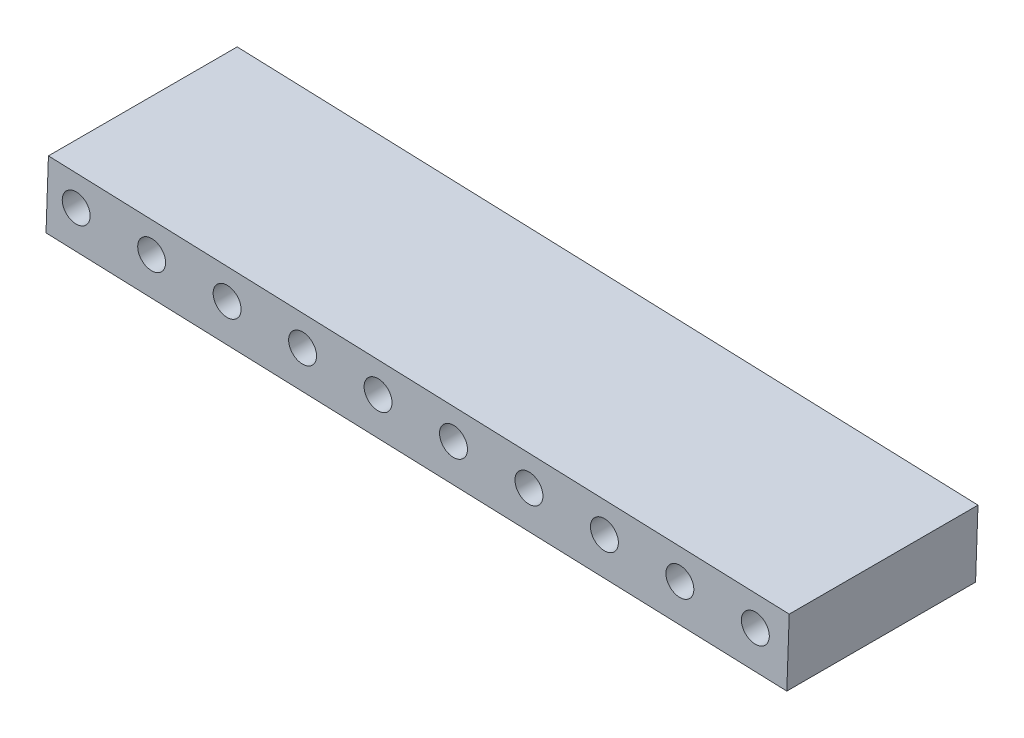
from build123d import *
from build123d.topology import SkipClean

# Parameters (mm, degrees)
EXTRUDE_3_DEPTH           = 5
SKETCH_4_R                = 1.5
SKETCH_4_R_2              = 4
CUT_EXTRUDE_3_DEPTH       = 5
SKETCH_5_R                = 11
CUT_EXTRUDE_4_DEPTH       = 2
SKETCH_6_R                = 1.5
CUT_EXTRUDE_6_DEPTH       = 169.745370307
SKETCH_7_R                = 1.5
CUT_EXTRUDE_7_DEPTH       = 10
SKETCH_8_R                = 11
CUT_EXTRUDE_8_DEPTH       = 10
SKETCH_9_R                = 1.5
CUT_EXTRUDE_9_DEPTH       = 10
SKETCH_10_R               = 5
CUT_EXTRUDE_10_DEPTH      = 10
SKETCH_11_R               = 1.5
SKETCH_11_R_2             = 2
CUT_EXTRUDE_11_DEPTH      = 10
SKETCH_12_W               = 41
SKETCH_12_H               = 22
CUT_EXTRUDE_12_DEPTH      = 10
SKETCH_13_R               = 1.5
CUT_EXTRUDE_13_DEPTH      = 10
EXTRUDE_4_DEPTH           = 5
SKETCH_15_R               = 1.5
EXTRUDE_6_DEPTH           = 5
SKETCH_16_R               = 1.5
CUT_EXTRUDE_14_DEPTH      = 5
EXTRUDE_7_DEPTH           = 5
CUT_EXTRUDE_15_DEPTH      = 5
CUT_EXTRUDE_19_DEPTH      = 5
SKETCH_21_R               = 1.5
CUT_EXTRUDE_20_DEPTH      = 5
EXTRUDE_8_DEPTH           = 10
SKETCH_23_R               = 1.5
CUT_EXTRUDE_21_DEPTH      = 15
SKETCH_24_R               = 1.5
EXTRUDE_9_DEPTH           = 10
SKETCH_25_W               = 266.832769714
SKETCH_25_H               = 72.102740534
CUT_EXTRUDE_22_DEPTH      = 139.940757694
SKETCH_27_R               = 1.85
CUT_EXTRUDE_23_DEPTH      = 139.940757694
CUT_EXTRUDE_25_DEPTH      = 139.940757694
CUT_EXTRUDE_25_DEPTH_BACK = 139.940757694


with BuildPart() as part:
    # 草图1 → 凸台-拉伸3 (new body)
    with BuildSketch(Plane.XY):
        with BuildLine():
            Line((140, 25), (0, 35))
            ThreePointArc((0, 35), (-35, 0), (0, -35))
            Line((0, -35), (140, -25))
            ThreePointArc((140, -25), (165, 0), (140, 25))
        make_face()
    extrude(amount=EXTRUDE_3_DEPTH)

    # 草图4 → 切除-拉伸3 (cut)
    with BuildSketch(Plane.XY.offset(5)):
        with Locations((-5, -5)):
            Circle(SKETCH_4_R)
        with Locations((5, -5)):
            Circle(SKETCH_4_R)
        with Locations((-5, 5)):
            Circle(SKETCH_4_R)
        with Locations((5, 5)):
            Circle(SKETCH_4_R)
        with Locations((135, -5)):
            Circle(SKETCH_4_R)
        with Locations((145, -5)):
            Circle(SKETCH_4_R)
        with Locations((135, 5)):
            Circle(SKETCH_4_R)
        with Locations((145, 5)):
            Circle(SKETCH_4_R)
        Circle(SKETCH_4_R_2)
        with Locations((140, 0)):
            Circle(SKETCH_4_R_2)
    extrude(amount=-CUT_EXTRUDE_3_DEPTH, mode=Mode.SUBTRACT)

    # 草图5 → 切除-拉伸4 (cut)
    with BuildSketch(Plane.XY.offset(5)):
        Circle(SKETCH_5_R)
        with Locations((140, 0)):
            Circle(SKETCH_5_R)
    extrude(amount=-CUT_EXTRUDE_4_DEPTH, mode=Mode.SUBTRACT)

    # 草图6 → 切除-拉伸6 (cut, through all)
    with BuildSketch(Plane.XY.offset(5)):
        with Locations((30, 0)):
            Circle(SKETCH_6_R)
        with Locations((25.980762114, 15)):
            Circle(SKETCH_6_R)
        with Locations((25.980762114, -15)):
            Circle(SKETCH_6_R)
        with Locations((15, 25.980762114)):
            Circle(SKETCH_6_R)
        with Locations((15, -25.980762114)):
            Circle(SKETCH_6_R)
        with Locations((0, 30)):
            Circle(SKETCH_6_R)
        with Locations((0, -30)):
            Circle(SKETCH_6_R)
        with Locations((-15, 25.980762114)):
            Circle(SKETCH_6_R)
        with Locations((-15, -25.980762114)):
            Circle(SKETCH_6_R)
        with Locations((-25.980762114, 15)):
            Circle(SKETCH_6_R)
        with Locations((-25.980762114, -15)):
            Circle(SKETCH_6_R)
        with Locations((-30, 0)):
            Circle(SKETCH_6_R)
        with Locations((160, 0)):
            Circle(SKETCH_6_R)
        with Locations((157.320508076, 10)):
            Circle(SKETCH_6_R)
        with Locations((157.320508076, -10)):
            Circle(SKETCH_6_R)
        with Locations((150, 17.320508076)):
            Circle(SKETCH_6_R)
        with Locations((150, -17.320508076)):
            Circle(SKETCH_6_R)
        with Locations((140, 20)):
            Circle(SKETCH_6_R)
        with Locations((140, -20)):
            Circle(SKETCH_6_R)
        with Locations((130, 17.320508076)):
            Circle(SKETCH_6_R)
        with Locations((130, -17.320508076)):
            Circle(SKETCH_6_R)
        with Locations((122.679491924, 10)):
            Circle(SKETCH_6_R)
        with Locations((122.679491924, -10)):
            Circle(SKETCH_6_R)
        with Locations((120, 0)):
            Circle(SKETCH_6_R)
    extrude(amount=-CUT_EXTRUDE_6_DEPTH, mode=Mode.SUBTRACT)

    # 草图7 → 切除-拉伸7 (cut)
    with SkipClean():  # the faces are left unmerged after this step: merging them gives an invalid solid
        with BuildSketch(Plane.XY.offset(5)):
            with BuildLine():
                ThreePointArc((138.21656051, 24.936305732), (139.107711737, 24.984071359), (140, 25))
                Line((140, 25), (0, 35))
                ThreePointArc((0, 35), (-35, 0), (0, -35))
                Line((0, -35), (140, -25))
                ThreePointArc((140, -25), (139.107711737, -24.984071359), (138.21656051, -24.936305732))
                Line((138.21656051, -24.936305732), (0, -20))
                ThreePointArc((0, -20), (-20, 0), (0, 20))
                Line((0, 20), (138.21656051, 24.936305732))
            make_face()
            with Locations((0, -30)):
                Circle(SKETCH_7_R, mode=Mode.SUBTRACT)
            with Locations((-15, -25.980762114)):
                Circle(SKETCH_7_R, mode=Mode.SUBTRACT)
            with Locations((15, -25.980762114)):
                Circle(SKETCH_7_R, mode=Mode.SUBTRACT)
            with Locations((-25.980762114, -15)):
                Circle(SKETCH_7_R, mode=Mode.SUBTRACT)
            with Locations((-30, 0)):
                Circle(SKETCH_7_R, mode=Mode.SUBTRACT)
            with Locations((-25.980762114, 15)):
                Circle(SKETCH_7_R, mode=Mode.SUBTRACT)
            with Locations((-15, 25.980762114)):
                Circle(SKETCH_7_R, mode=Mode.SUBTRACT)
            with Locations((0, 30)):
                Circle(SKETCH_7_R, mode=Mode.SUBTRACT)
            with Locations((15, 25.980762114)):
                Circle(SKETCH_7_R, mode=Mode.SUBTRACT)
        extrude(amount=-CUT_EXTRUDE_7_DEPTH, mode=Mode.SUBTRACT)

    # 草图8 → 切除-拉伸8 (cut)
    with SkipClean():  # the faces are left unmerged after this step: merging them gives an invalid solid
        with BuildSketch(Plane.XY.offset(5)):
            Circle(SKETCH_8_R)
        extrude(amount=-CUT_EXTRUDE_8_DEPTH, mode=Mode.SUBTRACT)

    # 草图9 → 切除-拉伸9 (cut)
    with SkipClean():  # the faces are left unmerged after this step: merging them gives an invalid solid
        with BuildSketch(Plane.XY.offset(5)):
            with Locations((15, 0)):
                Circle(SKETCH_9_R)
            with Locations((10.606601718, 10.606601718)):
                Circle(SKETCH_9_R)
            with Locations((10.606601718, -10.606601718)):
                Circle(SKETCH_9_R)
            with Locations((0, 15)):
                Circle(SKETCH_9_R)
            with Locations((0, -15)):
                Circle(SKETCH_9_R)
            with Locations((-10.606601718, 10.606601718)):
                Circle(SKETCH_9_R)
            with Locations((-10.606601718, -10.606601718)):
                Circle(SKETCH_9_R)
            with Locations((-15, 0)):
                Circle(SKETCH_9_R)
        extrude(amount=-CUT_EXTRUDE_9_DEPTH, mode=Mode.SUBTRACT)

    # 草图10 → 切除-拉伸10 (cut)
    with SkipClean():  # the faces are left unmerged after this step: merging them gives an invalid solid
        with BuildSketch(Plane.XY.offset(3)):
            with Locations((140, 0)):
                Circle(SKETCH_10_R)
        extrude(amount=-CUT_EXTRUDE_10_DEPTH, mode=Mode.SUBTRACT)

    # 草图11 → 切除-拉伸11 (cut)
    # profile 1 of 5: a face of its own
    with SkipClean():  # the faces are left unmerged after this step: merging them gives an invalid solid
        with BuildSketch(Plane.XY.offset(5)):
            with BuildLine():
                Line((124.179491924, -10), (150, -10))
                Line((150, -10), (150, 10))
                Line((150, 10), (124.179491924, 10))
                ThreePointArc((124.179491924, 10), (122.679491924, 8.5), (121.179491924, 10))
                Line((121.179491924, 10), (110, 10))
                Line((110, 10), (110, -10))
                Line((110, -10), (121.179491924, -10))
                ThreePointArc((121.179491924, -10), (122.679491924, -8.5), (124.179491924, -10))
            make_face()
            with Locations((120, 0)):
                Circle(SKETCH_11_R, mode=Mode.SUBTRACT)
        # profile 2 of 5: a face of its own
        with BuildSketch(Plane.XY.offset(5)):
            with Locations((105.5, 5)):
                Circle(SKETCH_11_R_2)
        # profile 3 of 5: a face of its own
        with BuildSketch(Plane.XY.offset(5)):
            with Locations((105.5, -5)):
                Circle(SKETCH_11_R_2)
        # profile 4 of 5: a face of its own
        with BuildSketch(Plane.XY.offset(5)):
            with Locations((154.5, -5)):
                Circle(SKETCH_11_R_2)
        # profile 5 of 5: a face of its own
        with BuildSketch(Plane.XY.offset(5)):
            with Locations((154.5, 5)):
                Circle(SKETCH_11_R_2)
        extrude(amount=-CUT_EXTRUDE_11_DEPTH, mode=Mode.SUBTRACT)

    # 草图12 → 切除-拉伸12 (cut)
    with SkipClean():  # the faces are left unmerged after this step: merging them gives an invalid solid
        with BuildSketch(Plane.XY.offset(5)):
            with Locations((130, 0)):
                Rectangle(SKETCH_12_W, SKETCH_12_H)
        extrude(amount=-CUT_EXTRUDE_12_DEPTH, mode=Mode.SUBTRACT)

    # 草图13 → 切除-拉伸13 (cut)
    with SkipClean():  # the faces are left unmerged after this step: merging them gives an invalid solid
        with BuildSketch(Plane.XY.offset(5)):
            with BuildLine():
                ThreePointArc((129.008722028, -18.446282468), (129.863637935, -21.138943397), (130.908449037, -18.514124575))
                ThreePointArc((130.908449037, -18.514124575), (129.94646687, -18.819552506), (129.008722028, -18.446282468))
            make_face()
            with Locations((119.923542522, -19.282983661)):
                Circle(SKETCH_13_R)
            with Locations((109.929913978, -18.926068356)):
                Circle(SKETCH_13_R)
            with Locations((99.936285435, -18.569153051)):
                Circle(SKETCH_13_R)
            with Locations((89.942656891, -18.212237746)):
                Circle(SKETCH_13_R)
            with Locations((79.949028348, -17.855322441)):
                Circle(SKETCH_13_R)
            with Locations((69.955399804, -17.498407136)):
                Circle(SKETCH_13_R)
            with Locations((59.961771261, -17.141491831)):
                Circle(SKETCH_13_R)
            with Locations((49.968142717, -16.784576526)):
                Circle(SKETCH_13_R)
            with Locations((39.974514174, -16.42766122)):
                Circle(SKETCH_13_R)
            with Locations((29.98088563, -16.070745915)):
                Circle(SKETCH_13_R)
            with Locations((19.987257087, -15.71383061)):
                Circle(SKETCH_13_R)
            with Locations((9.993628543, -15.356915305)):
                Circle(SKETCH_13_R)
        extrude(amount=-CUT_EXTRUDE_13_DEPTH, mode=Mode.SUBTRACT)

    # 草图14 → 凸台-拉伸4 (add)
    with SkipClean():  # the faces are left unmerged after this step: merging them gives an invalid solid
        with BuildSketch(Plane.XY.offset(5)):
            with BuildLine():
                ThreePointArc((130.908449037, -18.514124575), (131.344000289, -17.986588568), (131.5, -17.320508076))
                ThreePointArc((131.5, -17.320508076), (129.382309527, -15.953592395), (129.008722028, -18.446282468))
                ThreePointArc((129.008722028, -18.446282468), (129.970704195, -18.140854536), (130.908449037, -18.514124575))
            make_face()
        extrude(amount=-EXTRUDE_4_DEPTH)

    # 草图15 → 凸台-拉伸6 (add)
    with SkipClean():  # the faces are left unmerged after this step: merging them gives an invalid solid
        with BuildSketch(Plane.XY.offset(5)):
            with Locations((25.980762114, 15)):
                Circle(SKETCH_15_R)
            with Locations((30, 0)):
                Circle(SKETCH_15_R)
            with Locations((25.980762114, -15)):
                Circle(SKETCH_15_R)
        extrude(amount=-EXTRUDE_6_DEPTH)

    # 草图16 → 切除-拉伸14 (cut)
    with SkipClean():  # the faces are left unmerged after this step: merging them gives an invalid solid
        with BuildSketch(Plane.XY.offset(5)):
            with Locations((129.917171065, 19.639898967)):
                Circle(SKETCH_16_R)
            with Locations((119.923542522, 19.282983661)):
                Circle(SKETCH_16_R)
            with Locations((109.929913978, 18.926068356)):
                Circle(SKETCH_16_R)
            with Locations((99.936285435, 18.569153051)):
                Circle(SKETCH_16_R)
            with Locations((89.942656891, 18.212237746)):
                Circle(SKETCH_16_R)
            with Locations((79.949028348, 17.855322441)):
                Circle(SKETCH_16_R)
            with Locations((69.955399804, 17.498407136)):
                Circle(SKETCH_16_R)
            with Locations((59.961771261, 17.141491831)):
                Circle(SKETCH_16_R)
            with Locations((49.968142717, 16.784576526)):
                Circle(SKETCH_16_R)
            with Locations((39.974514174, 16.42766122)):
                Circle(SKETCH_16_R)
            with Locations((29.98088563, 16.070745915)):
                Circle(SKETCH_16_R)
            with Locations((19.987257087, 15.71383061)):
                Circle(SKETCH_16_R)
            with Locations((9.993628543, 15.356915305)):
                Circle(SKETCH_16_R)
        extrude(amount=-CUT_EXTRUDE_14_DEPTH, mode=Mode.SUBTRACT)

    # 草图17 → 凸台-拉伸7 (add)
    with SkipClean():  # the faces are left unmerged after this step: merging them gives an invalid solid
        with BuildSketch(Plane.XY.offset(5)):
            with BuildLine():
                ThreePointArc((129.008722028, 18.446282468), (129.382309527, 15.953592395), (131.5, 17.320508076))
                ThreePointArc((131.5, 17.320508076), (131.344000289, 17.986588568), (130.908449037, 18.514124575))
                ThreePointArc((130.908449037, 18.514124575), (129.970704195, 18.140854536), (129.008722028, 18.446282468))
            make_face()
        extrude(amount=-EXTRUDE_7_DEPTH)

    # 草图18 → 切除-拉伸15 (cut)
    with SkipClean():  # the faces are left unmerged after this step: merging them gives an invalid solid
        with BuildSketch(Plane.XY.offset(5)):
            with BuildLine():
                ThreePointArc((100, 0), (99.769776761, 6.781714021), (99.080167099, 13.532201878))
                Line((99.080167099, 13.532201878), (22.547372848, 10.798887797))
                ThreePointArc((22.547372848, 10.798887797), (24.379133713, 5.536952176), (25, 0))
                ThreePointArc((25, 0), (24.379133713, -5.536952176), (22.547372848, -10.798887797))
                Line((22.547372848, -10.798887797), (99.080167099, -13.532201878))
                ThreePointArc((99.080167099, -13.532201878), (99.769776761, -6.781714021), (100, 0))
            make_face()
        extrude(amount=-CUT_EXTRUDE_15_DEPTH, mode=Mode.SUBTRACT)

    # 草图19 → 切除-拉伸19 (cut)
    with SkipClean():  # the faces are left unmerged after this step: merging them gives an invalid solid
        with BuildSketch(Plane.XY.offset(5)):
            with BuildLine():
                Line((134.406294114, 15.794486823), (16.308878209, 11.576721969))
                Line((16.308878209, 11.576721969), (15.987654435, 20.570987658))
                Line((15.987654435, 20.570987658), (0, 20))
                ThreePointArc((0, 20), (-20, 0), (0, -20))
                Line((0, -20), (15.987654435, -20.570987658))
                Line((15.987654435, -20.570987658), (16.308878209, -11.576721969))
                Line((16.308878209, -11.576721969), (134.406294114, -15.794486823))
                ThreePointArc((134.406294114, -15.794486823), (156.755756012, 0), (134.406294114, 15.794486823))
            make_face()
        extrude(amount=-CUT_EXTRUDE_19_DEPTH, mode=Mode.SUBTRACT)

    # 草图21 → 切除-拉伸20 (cut)
    with SkipClean():  # the faces are left unmerged after this step: merging them gives an invalid solid
        with BuildSketch(Plane.XY.offset(5)):
            with BuildLine():
                ThreePointArc((134.406294114, 15.794486823), (146.604776394, 15.399100244), (155.298987649, 6.833471771))
                ThreePointArc((155.298987649, 6.833471771), (156.390745963, 5.651981367), (156.259259804, 4.048682523))
                ThreePointArc((156.259259804, 4.048682523), (156.755756012, 0), (156.259259804, -4.048682523))
                ThreePointArc((156.259259804, -4.048682523), (156.390745963, -5.651981367), (155.298987649, -6.833471771))
                ThreePointArc((155.298987649, -6.833471771), (146.604776394, -15.399100244), (134.406294114, -15.794486823))
                Line((134.406294114, -15.794486823), (134.08507034, -24.788752512))
                Line((134.08507034, -24.788752512), (138.21656051, -24.936305732))
                ThreePointArc((138.21656051, -24.936305732), (165, 0), (138.21656051, 24.936305732))
                Line((138.21656051, 24.936305732), (134.08507034, 24.788752512))
                Line((134.08507034, 24.788752512), (134.406294114, 15.794486823))
            make_face()
            with Locations((140, -20)):
                Circle(SKETCH_21_R, mode=Mode.SUBTRACT)
            with Locations((150, -17.320508076)):
                Circle(SKETCH_21_R, mode=Mode.SUBTRACT)
            with Locations((157.320508076, -10)):
                Circle(SKETCH_21_R, mode=Mode.SUBTRACT)
            with Locations((160, 0)):
                Circle(SKETCH_21_R, mode=Mode.SUBTRACT)
            with Locations((157.320508076, 10)):
                Circle(SKETCH_21_R, mode=Mode.SUBTRACT)
            with Locations((150, 17.320508076)):
                Circle(SKETCH_21_R, mode=Mode.SUBTRACT)
            with Locations((140, 20)):
                Circle(SKETCH_21_R, mode=Mode.SUBTRACT)
        extrude(amount=-CUT_EXTRUDE_20_DEPTH, mode=Mode.SUBTRACT)


with BuildPart() as cut_extrude_20_piece_1:
    # of the separate pieces the step leaves, piece 1, a body of its own (cut_extrude_20_pieces)
    add(part.part.solids().sort_by_distance((134.08507034, 24.788752512, 0))[0])



with BuildPart() as cut_extrude_20_piece_2:
    # of the separate pieces the step leaves, piece 2, a body of its own (cut_extrude_20_pieces)
    add(part.part.solids().sort_by_distance((134.08507034, -24.788752512, 0))[0])


with BuildPart() as cut_extrude_20_piece_1_1:
    with SkipClean():  # the faces are left unmerged after this step: merging them gives an invalid solid
        add(cut_extrude_20_piece_1.part)

        add(cut_extrude_20_piece_2.part)  # 凸台-拉伸8 merges 切除-拉伸20 piece 2
        # 草图22 → 凸台-拉伸8 (add)
        with BuildSketch(Plane(origin=(0, 0, 0), x_dir=(-1, 0, 0), z_dir=(0, 0, -1))):
            Polygon((-134.08507034, 24.788752512), (-134.406294114, 15.794486823), (-16.308878209, 11.576721969), (-15.987654435, 20.570987658), align=None)
            Polygon((-134.406294114, -15.794486823), (-134.08507034, -24.788752512), (-15.987654435, -20.570987658), (-16.308878209, -11.576721969), align=None)
        extrude(amount=EXTRUDE_8_DEPTH)

    # 草图23 → 切除-拉伸21 (cut)
    with SkipClean():  # the faces are left unmerged after this step: merging them gives an invalid solid
        with BuildSketch(Plane.XY.offset(5)):
            with Locations((19.987257087, 15.71383061)):
                Circle(SKETCH_23_R)
            with Locations((29.98088563, 16.070745915)):
                Circle(SKETCH_23_R)
            with Locations((39.974514174, 16.42766122)):
                Circle(SKETCH_23_R)
            with Locations((49.968142717, 16.784576526)):
                Circle(SKETCH_23_R)
            with Locations((59.961771261, 17.141491831)):
                Circle(SKETCH_23_R)
            with Locations((69.955399804, 17.498407136)):
                Circle(SKETCH_23_R)
            with Locations((79.949028348, 17.855322441)):
                Circle(SKETCH_23_R)
            with Locations((89.942656891, 18.212237746)):
                Circle(SKETCH_23_R)
            with Locations((99.936285435, 18.569153051)):
                Circle(SKETCH_23_R)
            with Locations((109.929913978, 18.926068356)):
                Circle(SKETCH_23_R)
            with Locations((119.923542522, 19.282983661)):
                Circle(SKETCH_23_R)
            with Locations((129.917171065, 19.639898967)):
                Circle(SKETCH_23_R)
            with Locations((129.917171065, -19.639898967)):
                Circle(SKETCH_23_R)
            with Locations((119.923542522, -19.282983661)):
                Circle(SKETCH_23_R)
            with Locations((109.929913978, -18.926068356)):
                Circle(SKETCH_23_R)
            with Locations((99.936285435, -18.569153051)):
                Circle(SKETCH_23_R)
            with Locations((89.942656891, -18.212237746)):
                Circle(SKETCH_23_R)
            with Locations((79.949028348, -17.855322441)):
                Circle(SKETCH_23_R)
            with Locations((69.955399804, -17.498407136)):
                Circle(SKETCH_23_R)
            with Locations((59.961771261, -17.141491831)):
                Circle(SKETCH_23_R)
            with Locations((49.968142717, -16.784576526)):
                Circle(SKETCH_23_R)
            with Locations((39.974514174, -16.42766122)):
                Circle(SKETCH_23_R)
            with Locations((29.98088563, -16.070745915)):
                Circle(SKETCH_23_R)
            with Locations((19.987257087, -15.71383061)):
                Circle(SKETCH_23_R)
        extrude(amount=-CUT_EXTRUDE_21_DEPTH, mode=Mode.SUBTRACT)

    # 草图24 → 凸台-拉伸9 (add)
    # profile 1 of 2: a face of its own
    with BuildSketch(Plane(origin=(0, 0, -10), x_dir=(-1, 0, 0), z_dir=(0, 0, -1))):
        Polygon((-134.08507034, 24.788752512), (-134.406294114, 15.794486823), (-16.308878209, 11.576721969), (-15.987654435, 20.570987658), align=None)
        with Locations((-129.917171065, 19.639898967)):
            Circle(SKETCH_24_R, mode=Mode.SUBTRACT)
        with Locations((-119.923542522, 19.282983661)):
            Circle(SKETCH_24_R, mode=Mode.SUBTRACT)
        with Locations((-109.929913978, 18.926068356)):
            Circle(SKETCH_24_R, mode=Mode.SUBTRACT)
        with Locations((-99.936285435, 18.569153051)):
            Circle(SKETCH_24_R, mode=Mode.SUBTRACT)
        with Locations((-89.942656891, 18.212237746)):
            Circle(SKETCH_24_R, mode=Mode.SUBTRACT)
        with Locations((-79.949028348, 17.855322441)):
            Circle(SKETCH_24_R, mode=Mode.SUBTRACT)
        with Locations((-69.955399804, 17.498407136)):
            Circle(SKETCH_24_R, mode=Mode.SUBTRACT)
        with Locations((-59.961771261, 17.141491831)):
            Circle(SKETCH_24_R, mode=Mode.SUBTRACT)
        with Locations((-49.968142717, 16.784576526)):
            Circle(SKETCH_24_R, mode=Mode.SUBTRACT)
        with Locations((-39.974514174, 16.42766122)):
            Circle(SKETCH_24_R, mode=Mode.SUBTRACT)
        with Locations((-29.98088563, 16.070745915)):
            Circle(SKETCH_24_R, mode=Mode.SUBTRACT)
        with Locations((-19.987257087, 15.71383061)):
            Circle(SKETCH_24_R, mode=Mode.SUBTRACT)
    # profile 2 of 2: a face of its own
    with BuildSketch(Plane(origin=(0, 0, -10), x_dir=(-1, 0, 0), z_dir=(0, 0, -1))):
        Polygon((-134.406294114, -15.794486823), (-134.08507034, -24.788752512), (-15.987654435, -20.570987658), (-16.308878209, -11.576721969), align=None)
        with Locations((-19.987257087, -15.71383061)):
            Circle(SKETCH_24_R, mode=Mode.SUBTRACT)
        with Locations((-29.98088563, -16.070745915)):
            Circle(SKETCH_24_R, mode=Mode.SUBTRACT)
        with Locations((-39.974514174, -16.42766122)):
            Circle(SKETCH_24_R, mode=Mode.SUBTRACT)
        with Locations((-49.968142717, -16.784576526)):
            Circle(SKETCH_24_R, mode=Mode.SUBTRACT)
        with Locations((-59.961771261, -17.141491831)):
            Circle(SKETCH_24_R, mode=Mode.SUBTRACT)
        with Locations((-69.955399804, -17.498407136)):
            Circle(SKETCH_24_R, mode=Mode.SUBTRACT)
        with Locations((-79.949028348, -17.855322441)):
            Circle(SKETCH_24_R, mode=Mode.SUBTRACT)
        with Locations((-89.942656891, -18.212237746)):
            Circle(SKETCH_24_R, mode=Mode.SUBTRACT)
        with Locations((-99.936285435, -18.569153051)):
            Circle(SKETCH_24_R, mode=Mode.SUBTRACT)
        with Locations((-109.929913978, -18.926068356)):
            Circle(SKETCH_24_R, mode=Mode.SUBTRACT)
        with Locations((-119.923542522, -19.282983661)):
            Circle(SKETCH_24_R, mode=Mode.SUBTRACT)
        with Locations((-129.917171065, -19.639898967)):
            Circle(SKETCH_24_R, mode=Mode.SUBTRACT)
    extrude(amount=EXTRUDE_9_DEPTH)

    # 草图25 → 切除-拉伸22 (cut, through all)
    with SkipClean():  # the faces are left unmerged after this step: merging them gives an invalid solid
        with BuildSketch(Plane.XY.offset(5)):
            with Locations((8.532639961, 40.788046652)):
                Rectangle(SKETCH_25_W, SKETCH_25_H)
        extrude(amount=-CUT_EXTRUDE_22_DEPTH, mode=Mode.SUBTRACT)

    # 草图27 → 切除-拉伸23 (cut, through all)
    with BuildSketch(Plane(origin=(0, 0, -20), x_dir=(-1, 0, 0), z_dir=(0, 0, -1))):
        with Locations((-129.917171065, -19.639898967)):
            Circle(SKETCH_27_R)
        with Locations((-119.923542522, -19.282983661)):
            Circle(SKETCH_27_R)
        with Locations((-109.929913978, -18.926068356)):
            Circle(SKETCH_27_R)
        with Locations((-99.936285435, -18.569153051)):
            Circle(SKETCH_27_R)
        with Locations((-89.942656891, -18.212237746)):
            Circle(SKETCH_27_R)
        with Locations((-79.949028348, -17.855322441)):
            Circle(SKETCH_27_R)
        with Locations((-69.955399804, -17.498407136)):
            Circle(SKETCH_27_R)
        with Locations((-59.961771261, -17.141491831)):
            Circle(SKETCH_27_R)
        with Locations((-49.968142717, -16.784576526)):
            Circle(SKETCH_27_R)
        with Locations((-39.974514174, -16.42766122)):
            Circle(SKETCH_27_R)
        with Locations((-29.98088563, -16.070745915)):
            Circle(SKETCH_27_R)
        with Locations((-19.987257087, -15.71383061)):
            Circle(SKETCH_27_R)
    extrude(amount=-CUT_EXTRUDE_23_DEPTH, mode=Mode.SUBTRACT)

    # 草图29 → 切除-拉伸25 (cut, two sides: drawn at the far end of the back side and taken through both)
    with BuildSketch(Plane.XY.offset(5).offset(-CUT_EXTRUDE_25_DEPTH_BACK)):
        Polygon((134.406294114, -15.794486823), (134.08507034, -24.788752512), (114.097813253, -24.074921902), (114.419037027, -15.080656213), align=None)
    extrude(amount=CUT_EXTRUDE_25_DEPTH + CUT_EXTRUDE_25_DEPTH_BACK, mode=Mode.SUBTRACT)


solid = cut_extrude_20_piece_1_1.part
